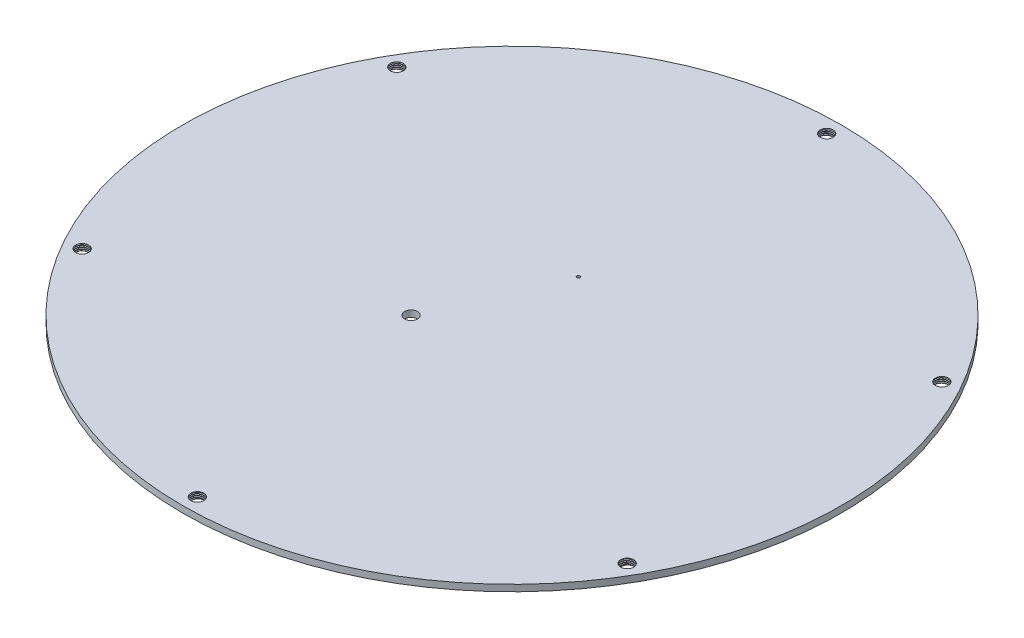
from build123d import *

# Parameters (mm, degrees)
SKETCH1_R               = 50.8
SKETCH1_R_2             = 1
BOSS_EXTRUDE1_DEPTH     = 1
THREAD1_PITCH           = 0.25
CIRPATTERN1_COUNT       = 6
CUT_EXTRUDE1_DEPTH      = 72.849008487
CUT_EXTRUDE1_DEPTH_BACK = 72.849008487
SKETCH2_R               = 0.25
SKETCH2_R_2             = 1


with BuildPart() as part:
    # Sketch1 → Boss-Extrude1 (new body)
    with BuildSketch(Plane(origin=(0, 0, 0), x_dir=(1, 0, 0), z_dir=(0, 1, 0))):
        with Locations(Location((0, 0, 0), (0, 0, 270))):
            Circle(SKETCH1_R)
        with Locations(Location((0, 48.5, 0), (0, 0, 270))):
            Circle(SKETCH1_R_2, mode=Mode.SUBTRACT)
        with Locations(Location((42.002232084, 24.25, 0), (0, 0, 270))):
            Circle(SKETCH1_R_2, mode=Mode.SUBTRACT)
        with Locations(Location((42.002232084, -24.25, 0), (0, 0, 270))):
            Circle(SKETCH1_R_2, mode=Mode.SUBTRACT)
        with Locations(Location((0, -48.5, 0), (0, 0, 270))):
            Circle(SKETCH1_R_2, mode=Mode.SUBTRACT)
        with Locations(Location((-42.002232084, -24.25, 0), (0, 0, 270))):
            Circle(SKETCH1_R_2, mode=Mode.SUBTRACT)
        with Locations(Location((-42.002232084, 24.25, 0), (0, 0, 270))):
            Circle(SKETCH1_R_2, mode=Mode.SUBTRACT)
    extrude(amount=BOSS_EXTRUDE1_DEPTH)

    # Thread1: arcs per turn and ends read off the stored shape
    # Thread1: the profile of Thread Profile1 profile screwed along a right-hand helix through 40 turns, 6 arcs to a turn; built about Z, then put on its axis
    thread1_z = Axis((0, 0, 0), (0, 0, 1))
    thread1_corners = [(0.9997, 0, -0.000173205), (1.135316468, 0, 0.078125), (1.135316468, 0, 0.109375), (0.9997, 0, 0.187673204)]
    with BuildLine(mode=Mode.PRIVATE) as thread1_profile:
        Line(thread1_corners[0], thread1_corners[1])
        Line(thread1_corners[1], thread1_corners[2])
        Line(thread1_corners[2], thread1_corners[3])
        Line(thread1_corners[3], thread1_corners[0])
    thread1_cap = Face(thread1_profile.wire())
    thread1_turn_angles = [0, 30, 60, 90, 120, 150, 180, 210, 240, 270, 300, 330, 360]
    thread1_turn_weights = [1, 0.8660254037844387, 1, 0.8660254037844387, 1, 0.8660254037844387, 1, 0.8660254037844387, 1, 0.8660254037844387, 1, 0.8660254037844387, 1]
    thread1_turn_rails = [Edge.make_bspline([Vector(p[0], p[1], 0).rotate(thread1_z, thread1_turn_angles[k]) / thread1_turn_weights[k] + Vector(0, 0, p[2] + THREAD1_PITCH * thread1_turn_angles[k] / 360) for k in range(13)], [0, 0, 0, 1, 1, 2, 2, 3, 3, 4, 4, 5, 5, 6, 6, 6], 2, thread1_turn_weights) for p in thread1_corners]
    thread1_turn_sides = [Face.make_surface_from_curves(thread1_turn_rails[p[0]], thread1_turn_rails[p[1]]) for p in [(0, 1), (1, 2), (2, 3), (3, 0)]]
    thread1 = Plane(origin=(-42.002232084, 1, 24.25), x_dir=(-1, 0, 0), z_dir=(0, -1, 0)) * Solid(Shell([*[p.moved(Location((0, 0, THREAD1_PITCH * i))) for i in range(40) for p in thread1_turn_sides], thread1_cap, thread1_cap.rotate(thread1_z, 14400).moved(Location((0, 0, THREAD1_PITCH * 14400 / 360)))]))
    add(thread1, mode=Mode.SUBTRACT)

    # CirPattern1: Thread1 ×6 about axis
    cirpattern1_axis = Axis((0, 0, 0), (0, 1, 0))
    for i in range(1, CIRPATTERN1_COUNT):
        add(thread1.rotate(cirpattern1_axis, i * 360 / CIRPATTERN1_COUNT), mode=Mode.SUBTRACT)

    # Sketch2 → Cut-Extrude1 (cut, two sides: drawn at the far end of the back side and taken through both)
    with BuildSketch(Plane(origin=(0, 1, 0), x_dir=(1, 0, 0), z_dir=(0, 1, 0)).offset(-CUT_EXTRUDE1_DEPTH_BACK)):
        with Locations(Location((0, 10.25, 0), (0, 0, 270))):
            Circle(SKETCH2_R)
        with Locations(Location((-7.778174593, -7.778174593, 0), (0, 0, 270))):
            Circle(SKETCH2_R_2)
    extrude(amount=CUT_EXTRUDE1_DEPTH + CUT_EXTRUDE1_DEPTH_BACK, mode=Mode.SUBTRACT)


solid = part.part
